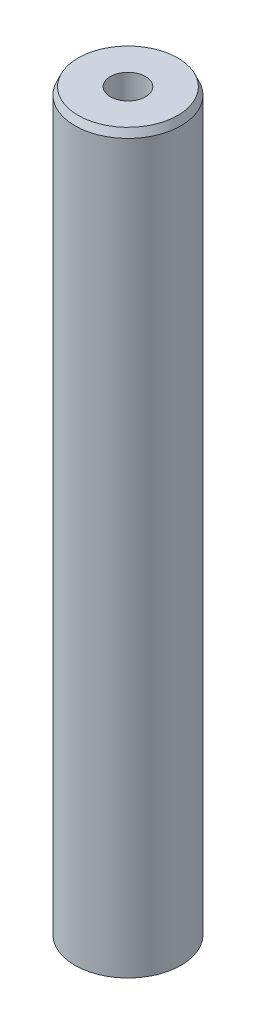
from build123d import *
from OCP.BRepFilletAPI import BRepFilletAPI_MakeChamfer

# Parameters (mm, degrees)
SKETCH1_R           = 35
BOSS_EXTRUDE1_DEPTH = 486.424898546
SKETCH2_R           = 11.596743529
CUT_EXTRUDE1_DEPTH  = 489.936787249
CHAMFER1_SIZE       = 4.828720008
CHAMFER1_SIZE2      = 2.160183062


with BuildPart() as part:
    # Sketch1 → Boss-Extrude1 (new body)
    with BuildSketch(Plane(origin=(0, 0, 0), x_dir=(1, 0, 0), z_dir=(0, 1, 0))):
        Circle(SKETCH1_R)
    extrude(amount=BOSS_EXTRUDE1_DEPTH)

    # Sketch2 → Cut-Extrude1 (cut, through all)
    with BuildSketch(Plane(origin=(0, 0, 0), x_dir=(1, 0, 0), z_dir=(0, 1, 0))):
        Circle(SKETCH2_R)
    extrude(amount=CUT_EXTRUDE1_DEPTH, mode=Mode.SUBTRACT)

    # Chamfer1: one chamfer whose edges measure the first distance from different faces: ONE call of the kernel's chamfer builder (chamfer() names one face for all edges)
    chamfer1_edges_1 = [part.edges().sort_by_distance(p)[0] for p in [
        (-35, 486.424898546, 0),
    ]]
    chamfer1_side_1 = [part.faces().sort_by_distance(p)[0] for p in [
        (-35, 243.212449273, 0),
    ]]
    chamfer1_edges_2 = [part.edges().sort_by_distance(p)[0] for p in [
        (-35, 0, 0),
    ]]
    chamfer1_side_2 = [part.faces().sort_by_distance(p)[0] for p in [
        (-34.010050506, 0, 0),
    ]]
    chamfer1 = BRepFilletAPI_MakeChamfer(part.part.solid().wrapped)
    for e in chamfer1_edges_1:
        chamfer1.Add(CHAMFER1_SIZE, CHAMFER1_SIZE2, e.wrapped, chamfer1_side_1[0].wrapped)  # the first distance lies on this face
    for e in chamfer1_edges_2:
        chamfer1.Add(CHAMFER1_SIZE, CHAMFER1_SIZE2, e.wrapped, chamfer1_side_2[0].wrapped)  # the first distance lies on this face
    add(Compound.cast(chamfer1.Shape()), mode=Mode.REPLACE)


solid = part.part
